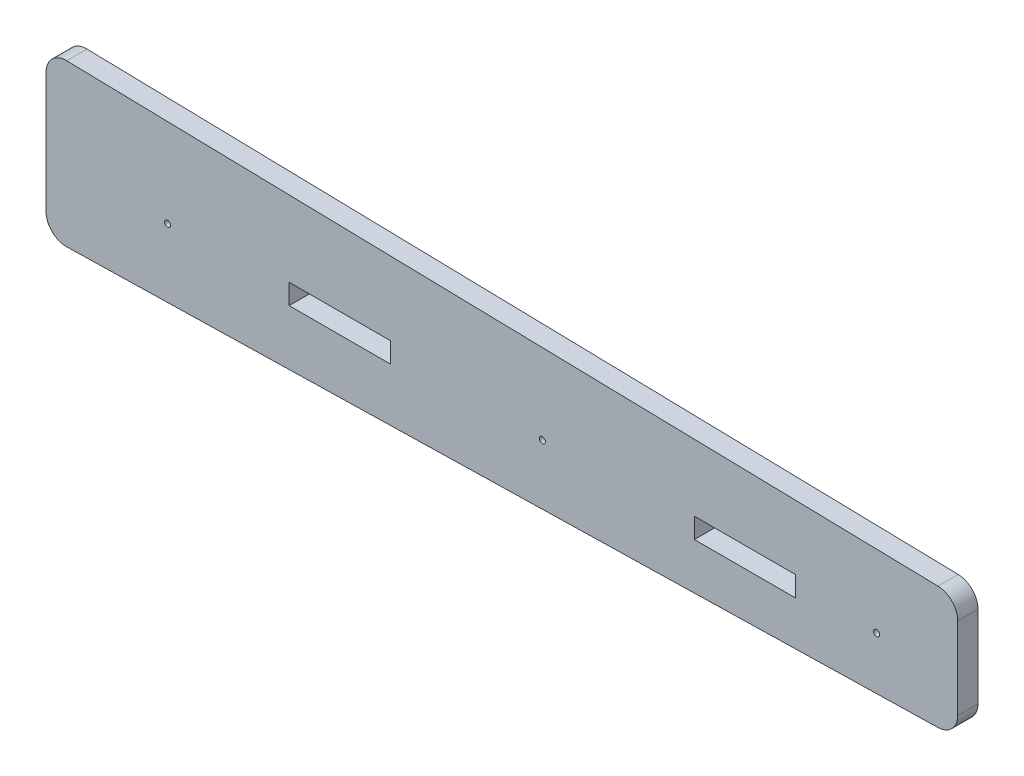
from build123d import *

# Parameters (mm, degrees)
SKETCH1_W              = 50
SKETCH1_H              = 10
EXTRUDE_583_DEPTH      = 10
FILLET1_R              = 10
CUT_EXTRUDE_1186_REACH = 230.707
SKETCH2_R              = 1.5


with BuildPart() as part:
    # Sketch1 → Extrude 583 (new body)
    with BuildSketch(Plane.XY):
        Polygon((-225, 40), (-225, -40), (225, -30), (225, 30), align=None)
        with Locations((-80, -5)):
            Rectangle(SKETCH1_W, SKETCH1_H, mode=Mode.SUBTRACT)
        with Locations((120, -5)):
            Rectangle(SKETCH1_W, SKETCH1_H, mode=Mode.SUBTRACT)
    extrude(amount=EXTRUDE_583_DEPTH)

    # Fillet1
    fillet1_edges = [part.edges().sort_by_distance(p)[0] for p in [
        (-225, -40, 5),
        (-225, 40, 5),
        (225, -30, 5),
        (225, 30, 5),
    ]]
    fillet(fillet1_edges, radius=FILLET1_R)

    # Sketch2 → Cut-Extrude 1186 (cut, up to next)
    with BuildSketch(Plane.XY.offset(10), mode=Mode.PRIVATE) as cut_extrude_1186_sk1:
        with Locations((-165, -5)):
            Circle(SKETCH2_R)
    cut_extrude_1186_tool1 = extrude(cut_extrude_1186_sk1.sketch, amount=-CUT_EXTRUDE_1186_REACH, mode=Mode.PRIVATE) & part.part
    # Sketch2 → Cut-Extrude 1186 (cut, up to next)
    with BuildSketch(Plane.XY.offset(10), mode=Mode.PRIVATE) as cut_extrude_1186_sk2:
        with Locations((20, -5)):
            Circle(SKETCH2_R)
    cut_extrude_1186_tool2 = extrude(cut_extrude_1186_sk2.sketch, amount=-CUT_EXTRUDE_1186_REACH, mode=Mode.PRIVATE) & part.part
    # Sketch2 → Cut-Extrude 1186 (cut, up to next)
    with BuildSketch(Plane.XY.offset(10), mode=Mode.PRIVATE) as cut_extrude_1186_sk3:
        with Locations((185, -5)):
            Circle(SKETCH2_R)
    cut_extrude_1186_tool3 = extrude(cut_extrude_1186_sk3.sketch, amount=-CUT_EXTRUDE_1186_REACH, mode=Mode.PRIVATE) & part.part
    add(cut_extrude_1186_tool1.solids().sort_by_distance((-165, -5, 10))[0], mode=Mode.SUBTRACT)
    add(cut_extrude_1186_tool2.solids().sort_by_distance((20, -5, 10))[0], mode=Mode.SUBTRACT)
    add(cut_extrude_1186_tool3.solids().sort_by_distance((185, -5, 10))[0], mode=Mode.SUBTRACT)


solid = part.part
